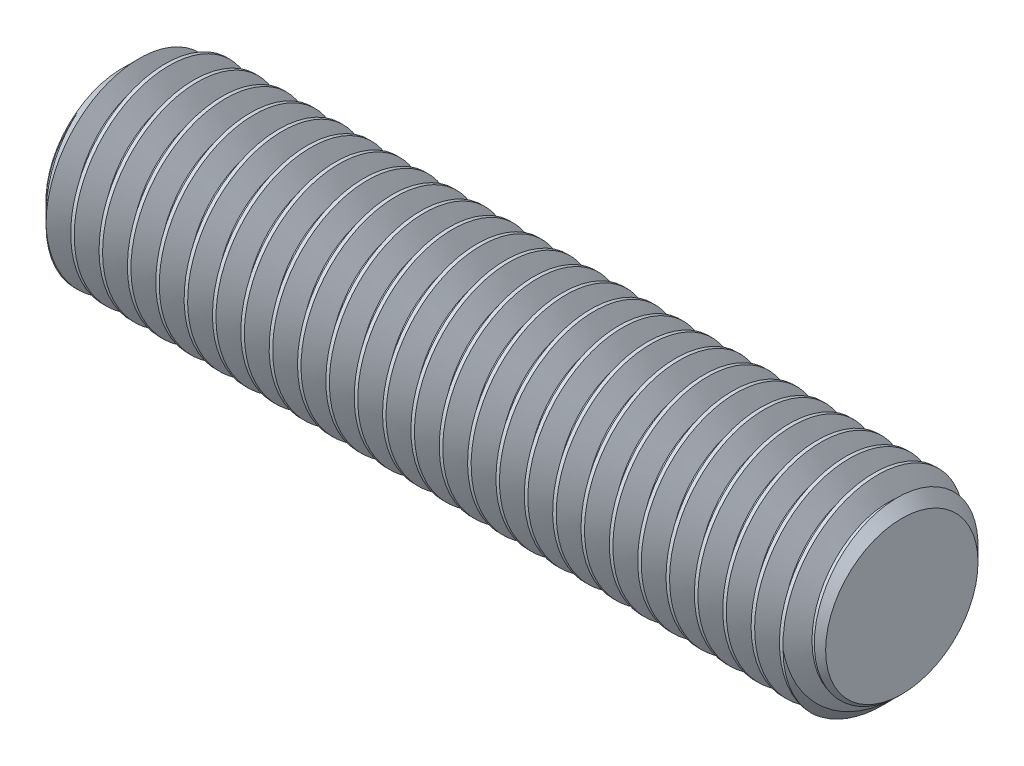
from build123d import *

# Parameters (mm, degrees)
BOSS_EXTRUDE1_DEPTH      = 31.75
BOSS_EXTRUDE1_DEPTH_BACK = 31.75
SKETCH2_R                = 7.9375
CHAMFER1_SIZE            = 1.731818182
CUT_SWEEP3_PITCH         = 2.309090909


with BuildPart() as part:
    # Sketch2 → Boss-Extrude1 (new, two sides: drawn at the far end of the back side and taken through both)
    with BuildSketch(Plane(origin=(0, 0, 0), x_dir=(0, 0, -1), z_dir=(1, 0, 0)).offset(-BOSS_EXTRUDE1_DEPTH_BACK)):
        Circle(SKETCH2_R)
    extrude(amount=BOSS_EXTRUDE1_DEPTH + BOSS_EXTRUDE1_DEPTH_BACK)

    # Chamfer1
    chamfer1_edges = [part.edges().sort_by_distance(p)[0] for p in [
        (-31.75, 0, 7.9375),
        (31.75, 0, 7.9375),
    ]]
    chamfer(chamfer1_edges, length=CHAMFER1_SIZE)

    # Cut-Sweep3: the profile of Sketch4 screwed along a right-hand helix of 28.5 turns, 10 arcs to a turn; built about Z, then put on its axis
    cut_sweep3_z = Axis((0, 0, 0), (0, 0, 1))
    cut_sweep3_corners = [(6.43770146, 0, -0.865909091), (8.062483212, 0, 0.072159091), (8.062483212, 0, -2.092613636), (6.43770146, 0, -1.154545455)]
    with BuildLine(mode=Mode.PRIVATE) as cut_sweep3_profile:
        Line(cut_sweep3_corners[0], cut_sweep3_corners[1])
        Line(cut_sweep3_corners[1], cut_sweep3_corners[2])
        Line(cut_sweep3_corners[2], cut_sweep3_corners[3])
        Line(cut_sweep3_corners[3], cut_sweep3_corners[0])
    cut_sweep3_cap = Face(cut_sweep3_profile.wire())
    cut_sweep3_turn_angles = [0, 18, 36, 54, 72, 90, 108, 126, 144, 162, 180, 198, 216, 234, 252, 270, 288, 306, 324, 342, 360]
    cut_sweep3_turn_weights = [1, 0.9510565162951535, 1, 0.9510565162951535, 1, 0.9510565162951535, 1, 0.9510565162951535, 1, 0.9510565162951535, 1, 0.9510565162951535, 1, 0.9510565162951535, 1, 0.9510565162951535, 1, 0.9510565162951535, 1, 0.9510565162951535, 1]
    cut_sweep3_turn_rails = [Edge.make_bspline([Vector(p[0], p[1], 0).rotate(cut_sweep3_z, cut_sweep3_turn_angles[k]) / cut_sweep3_turn_weights[k] + Vector(0, 0, p[2] + CUT_SWEEP3_PITCH * cut_sweep3_turn_angles[k] / 360) for k in range(21)], [0, 0, 0, 1, 1, 2, 2, 3, 3, 4, 4, 5, 5, 6, 6, 7, 7, 8, 8, 9, 9, 10, 10, 10], 2, cut_sweep3_turn_weights) for p in cut_sweep3_corners]
    cut_sweep3_turn_sides = [Face.make_surface_from_curves(cut_sweep3_turn_rails[p[0]], cut_sweep3_turn_rails[p[1]]) for p in [(0, 1), (1, 2), (2, 3), (3, 0)]]
    cut_sweep3_last_angles = [10080, 10098, 10116, 10134, 10152, 10170, 10188, 10206, 10224, 10242, 10260]
    cut_sweep3_last_weights = [1, 0.9510565162951535, 1, 0.9510565162951535, 1, 0.9510565162951535, 1, 0.9510565162951535, 1, 0.9510565162949917, 1]
    cut_sweep3_last_rails = [Edge.make_bspline([Vector(p[0], p[1], 0).rotate(cut_sweep3_z, cut_sweep3_last_angles[k]) / cut_sweep3_last_weights[k] + Vector(0, 0, p[2] + CUT_SWEEP3_PITCH * cut_sweep3_last_angles[k] / 360) for k in range(11)], [0, 0, 0, 1, 1, 2, 2, 3, 3, 4, 4, 5, 5, 5], 2, cut_sweep3_last_weights) for p in cut_sweep3_corners]
    cut_sweep3_last_sides = [Face.make_surface_from_curves(cut_sweep3_last_rails[p[0]], cut_sweep3_last_rails[p[1]]) for p in [(0, 1), (1, 2), (2, 3), (3, 0)]]
    cut_sweep3 = Plane(origin=(31.75, 0, 0), x_dir=(0, 1, 0), z_dir=(-1, 0, 0)) * Solid(Shell([*[p.moved(Location((0, 0, CUT_SWEEP3_PITCH * i))) for i in range(28) for p in cut_sweep3_turn_sides], *cut_sweep3_last_sides, cut_sweep3_cap, cut_sweep3_cap.rotate(cut_sweep3_z, 10260).moved(Location((0, 0, CUT_SWEEP3_PITCH * 10260 / 360)))]))
    add(cut_sweep3, mode=Mode.SUBTRACT)


solid = part.part
